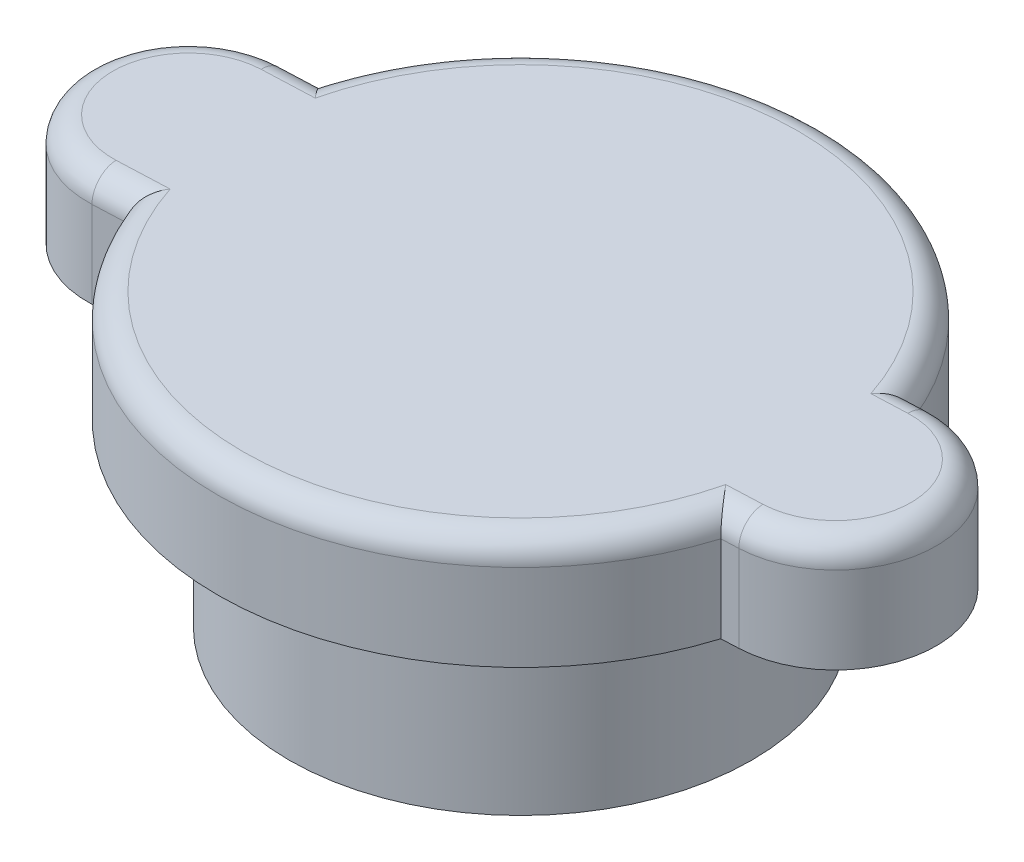
from build123d import *

# Parameters (mm, degrees)
SKETCH11_R = 18.415
NECK_DEPTH = 14.224
SKETCH12_R = 24.098503073
LID_DEPTH  = 8.89
FILLET3_R  = 2


with BuildPart() as part:
    # Sketch11 → neck (new body)
    with BuildSketch(Plane(origin=(0, 0, 0), x_dir=(1, 0, 0), z_dir=(0, 1, 0))):
        Circle(SKETCH11_R)
    extrude(amount=NECK_DEPTH)

    # Sketch12 → lid (add)
    with BuildSketch(Plane(origin=(0, 14.224, 0), x_dir=(1, 0, 0), z_dir=(0, 1, 0))):
        Circle(SKETCH12_R)
        with BuildLine():
            Line((-25.707660556, 6.978419473), (23.749239481, 9.0074205))
            ThreePointArc((23.749239481, 9.0074205), (32.097843424, 1.316834602), (24.407257526, -7.031769341))
            Line((24.407257526, -7.031769341), (-25.049642512, -9.060770368))
            ThreePointArc((-25.049642512, -9.060770368), (-33.398246454, -1.37018447), (-25.707660556, 6.978419473))
        make_face()
    extrude(amount=LID_DEPTH)

    # Fillet3
    fillet3_edges = [part.edges().sort_by_distance(p)[0] for p in [
        (23.061856817, 23.114, -8.979220186),
        (32.097843424, 23.114, -1.316834602),
        (23.719874862, 23.114, 7.059969655),
        (0.98782558, 23.114, 24.078248504),
        (-23.712058333, 23.114, 9.00589512),
        (-33.398246454, 23.114, 1.37018447),
        (-24.370076377, 23.114, -7.033294721),
        (-0.98782558, 23.114, -24.078248504),
    ]]
    fillet(fillet3_edges, radius=FILLET3_R)


solid = part.part
